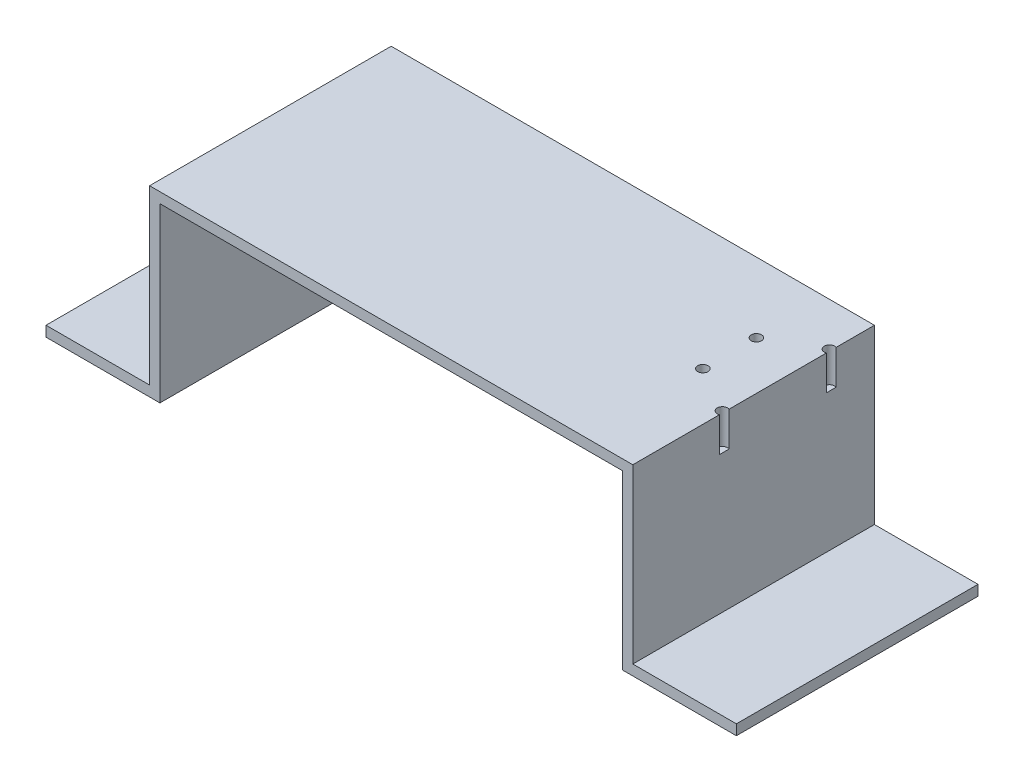
from build123d import *

# Parameters (mm, degrees)
EXTRUDE_1_DEPTH     = 70
SKETCH_2_R          = 1.5
CUT_EXTRUDE_1_DEPTH = 10


with BuildPart() as part:
    # 草图1 → 凸台-拉伸1 (new body)
    with BuildSketch(Plane.XY):
        Polygon((0, 0), (30, 0), (30, 50), (170, 50), (170, 0), (200, 0), (200, -3), (167, -3), (167, 47), (33, 47), (33, -3), (0, -3), align=None)
    extrude(amount=EXTRUDE_1_DEPTH)

    # 草图2 → 切除-拉伸1 (cut)
    with BuildSketch(Plane(origin=(0, 50, 0), x_dir=(1, 0, 0), z_dir=(0, 1, 0))):
        with Locations((169.468192828, -43.499999996)):
            Circle(SKETCH_2_R)
        with Locations((182.891586586, -35.749999996)):
            Circle(SKETCH_2_R)
        with Locations((182.891586586, -20.249999996)):
            Circle(SKETCH_2_R)
        with Locations((169.468192828, -12.499999996)):
            Circle(SKETCH_2_R)
        with Locations((156.044799069, -35.749999996)):
            Circle(SKETCH_2_R)
        with Locations((156.044799069, -20.249999996)):
            Circle(SKETCH_2_R)
    extrude(amount=-CUT_EXTRUDE_1_DEPTH, mode=Mode.SUBTRACT)


solid = part.part
